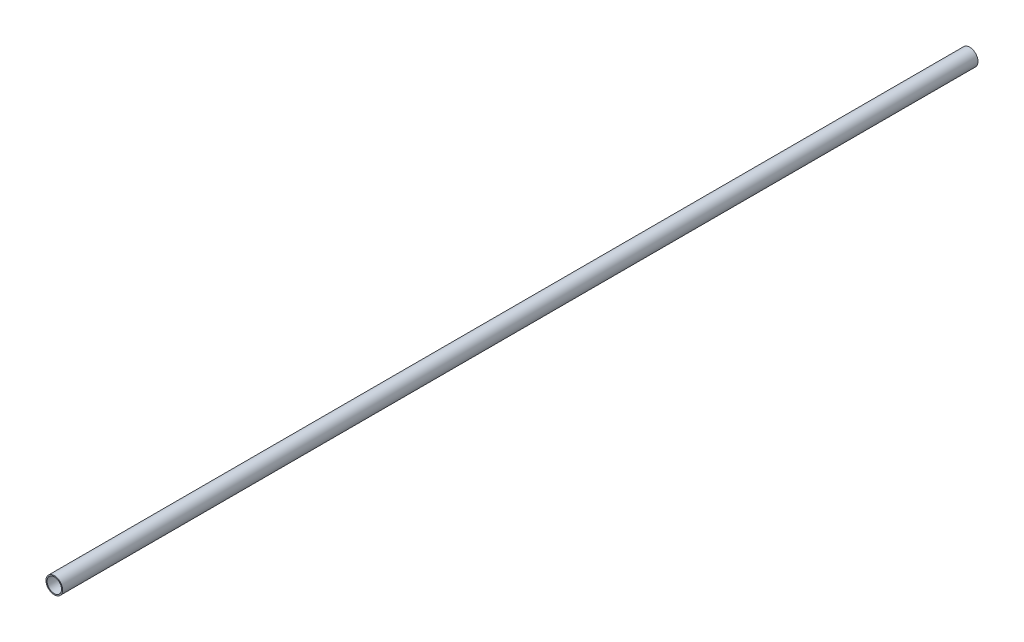
from build123d import *

# Parameters (mm, degrees)
SKETCH1_R           = 12.7
SKETCH1_R_2         = 11.049
BOSS_EXTRUDE1_DEPTH = 1397


with BuildPart() as part:
    # Sketch1 → Boss-Extrude1 (new body)
    with BuildSketch(Plane.XY):
        Circle(SKETCH1_R)
        Circle(SKETCH1_R_2, mode=Mode.SUBTRACT)
    extrude(amount=BOSS_EXTRUDE1_DEPTH)


solid = part.part
